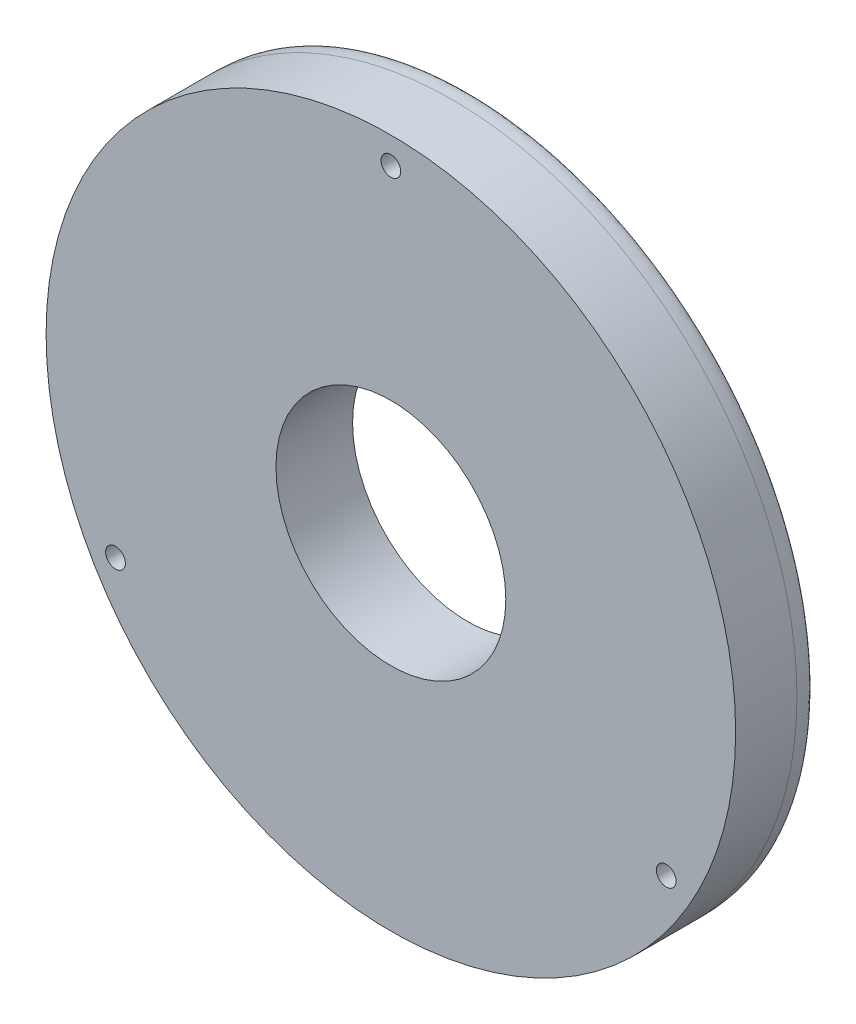
from build123d import *

# Parameters (mm, degrees)
SKETCH1_R           = 114.3
SKETCH1_R_2         = 38.1
BOSS_EXTRUDE1_DEPTH = 25.4
CIRPATTERN1_COUNT   = 3
FILLET1_SIZE        = 5.08
FILLET1_SIZE_2      = 1.27


with BuildPart() as part:
    # Sketch1 → Boss-Extrude1 (new body)
    with BuildSketch(Plane.XY):
        Circle(SKETCH1_R)
        Circle(SKETCH1_R_2, mode=Mode.SUBTRACT)
    extrude(amount=BOSS_EXTRUDE1_DEPTH)

    # Sketch5 → CBORE for 1/4 Socket Head Cap Screw1 (revolve, cut)
    with BuildSketch(Plane(origin=(0, 105.41, 0), x_dir=(0, 1, 0), z_dir=(1, 0, 0))):
        Polygon((0, 0), (0, 27.361148974), (3.2639, 25.4), (3.2639, 6.35), (5.55625, 6.35), (5.55625, 0), align=None)
    cbore_for_1_4_socket_head_cap_screw1 = revolve(axis=Axis((0, 105.41, -6.35), (0, 0, 1)), mode=Mode.SUBTRACT)

    # CirPattern1: CBORE for 1/4 Socket Head Cap Screw1 ×3 about axis
    cirpattern1_axis = Axis((0, 0, 0), (0, 0, 1))
    for i in range(1, CIRPATTERN1_COUNT):
        add(cbore_for_1_4_socket_head_cap_screw1.rotate(cirpattern1_axis, i * 360 / CIRPATTERN1_COUNT), mode=Mode.SUBTRACT)

    # Fillet1
    # a fillet whose section is not a circle: 5.08, 1.27 mm, written as the material it takes off along each edge
    with BuildSketch(Plane(origin=(0, 0, 0), x_dir=(1, 0, 0), z_dir=(0, -1, 0))) as fillet1_piece_1:
        with BuildLine():
            Bezier((114.3, FILLET1_SIZE), (114.3, 0), (114.3 - FILLET1_SIZE_2, 0), weights=[1, 1.857142857, 1])
            Line((114.3 - FILLET1_SIZE_2, 0), (113.03, -0.1016))
            Line((113.03, -0.1016), (114.4016, -0.1016))
            Line((114.4016, -0.1016), (114.4016, 5.08))
            Line((114.4016, 5.08), (114.3, FILLET1_SIZE))
        make_face()
    revolve(axis=Axis((0, 0, 0), (0, 0, 1)), mode=Mode.SUBTRACT)


solid = part.part
